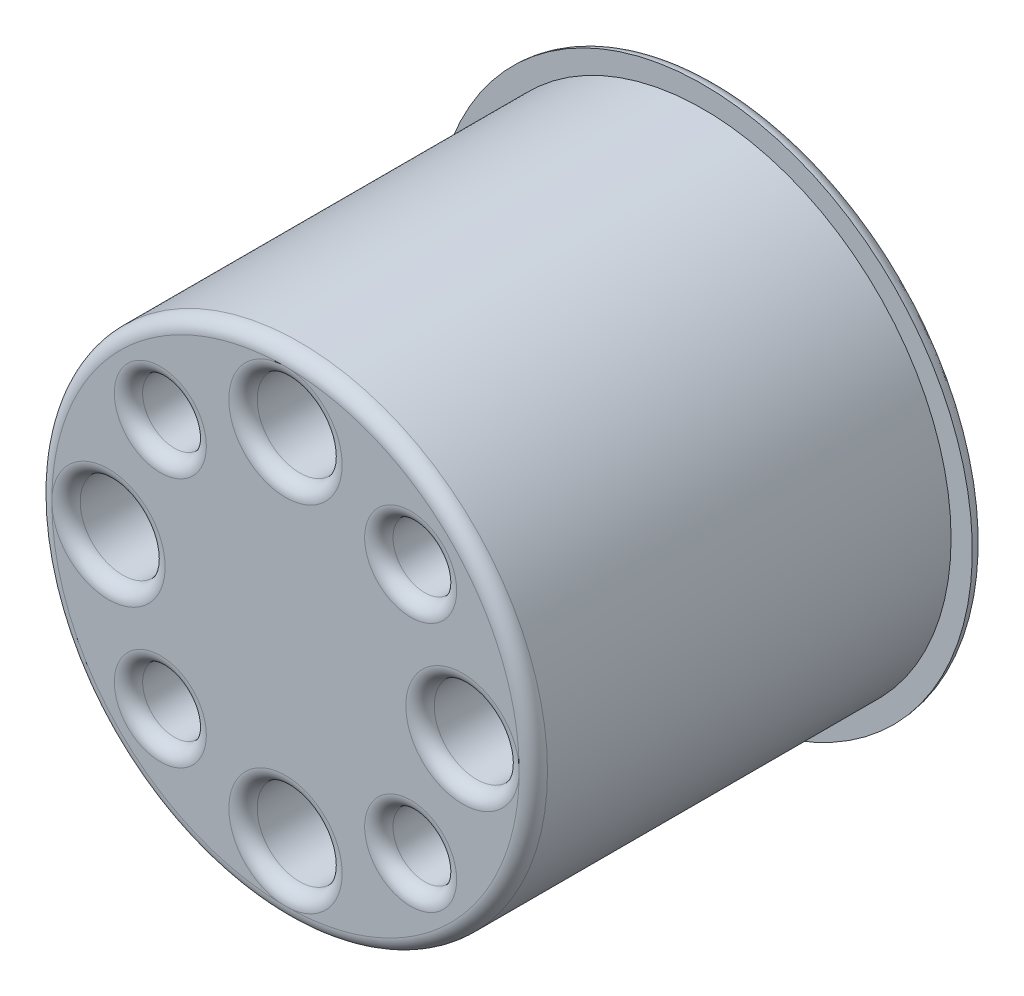
from build123d import *
from build123d.topology import SkipClean

# Parameters (mm, degrees)
SKIZZE1_R                       = 17.5
SKIZZE1_R_2                     = 1.65
AUFSATZ_LINEAR_AUSTRAGEN1_DEPTH = 29.5
AUFSATZ_LINEAR_START            = 1
SKIZZE2_R                       = 19
SKIZZE2_R_2                     = 1.65
AUFSATZ_LINEAR_AUSTRAGEN2_DEPTH = 1
SKIZZE3_R                       = 3
SCHNITT_LINEAR_AUSTRAGEN1_DEPTH = 21.5
SKIZZE4_R                       = 2.25
SCHNITT_LINEAR_AUSTRAGEN2_DEPTH = 10
VERRUNDUNG1_R                   = 1


with BuildPart() as part:
    # Skizze1 → Aufsatz-Linear austragen1 (new body)
    with BuildSketch(Plane.XY):
        Circle(SKIZZE1_R)
        with Locations((0, -12.5)):
            Circle(SKIZZE1_R_2, mode=Mode.SUBTRACT)
        with Locations((-12.5, 0)):
            Circle(SKIZZE1_R_2, mode=Mode.SUBTRACT)
        with Locations((0, 12.5)):
            Circle(SKIZZE1_R_2, mode=Mode.SUBTRACT)
        with Locations((12.5, 0)):
            Circle(SKIZZE1_R_2, mode=Mode.SUBTRACT)
    extrude(amount=AUFSATZ_LINEAR_AUSTRAGEN1_DEPTH)

    # Skizze2 → Aufsatz-Linear austragen2 (add)
    with SkipClean():  # the faces are left unmerged after this step: merging them gives an invalid solid
        with BuildSketch(Plane(origin=(0, 0, 0), x_dir=(-1, 0, 0), z_dir=(0, 0, -1)).offset(AUFSATZ_LINEAR_START)):
            Circle(SKIZZE2_R)
            with Locations((0, 12.5)):
                Circle(SKIZZE2_R_2, mode=Mode.SUBTRACT)
            with Locations((12.5, 0)):
                Circle(SKIZZE2_R_2, mode=Mode.SUBTRACT)
            with Locations((0, -12.5)):
                Circle(SKIZZE2_R_2, mode=Mode.SUBTRACT)
            with Locations((-12.5, 0)):
                Circle(SKIZZE2_R_2, mode=Mode.SUBTRACT)
        extrude(amount=-AUFSATZ_LINEAR_AUSTRAGEN2_DEPTH)

    # Skizze3 → Schnitt-Linear austragen1 (cut)
    with BuildSketch(Plane.XY.offset(29.5)):
        with Locations((0, 12.5)):
            Circle(SKIZZE3_R)
        with Locations((12.5, 0)):
            Circle(SKIZZE3_R)
        with Locations((0, -12.5)):
            Circle(SKIZZE3_R)
        with Locations((-12.5, 0)):
            Circle(SKIZZE3_R)
    extrude(amount=-SCHNITT_LINEAR_AUSTRAGEN1_DEPTH, mode=Mode.SUBTRACT)

    # Skizze4 → Schnitt-Linear austragen2 (cut)
    with BuildSketch(Plane.XY.offset(29.5)):
        with Locations((8.838834765, 8.838834765)):
            Circle(SKIZZE4_R)
        with Locations((8.838834765, -8.838834765)):
            Circle(SKIZZE4_R)
        with Locations((-8.838834765, -8.838834765)):
            Circle(SKIZZE4_R)
        with Locations((-8.838834765, 8.838834765)):
            Circle(SKIZZE4_R)
    extrude(amount=-SCHNITT_LINEAR_AUSTRAGEN2_DEPTH, mode=Mode.SUBTRACT)

    # Verrundung1
    # the kernel refuses this fillet: 1 mm, written as the material it takes off along each edge
    with BuildSketch(Plane(origin=(0, 0, -1), x_dir=(-1, 0, 0), z_dir=(0, -1, 0))) as verrundung1_piece_1:
        with BuildLine():
            CenterArc((19 - VERRUNDUNG1_R, -VERRUNDUNG1_R), VERRUNDUNG1_R, 0, 90)
            Line((19 - VERRUNDUNG1_R, 0), (19, 0))
            Line((19, 0), (19, -VERRUNDUNG1_R))
        make_face()
    revolve(axis=Axis((0, 0, -1), (0, 0, -1)), mode=Mode.SUBTRACT)
    with BuildSketch(Plane(origin=(0, 12.5, -1), x_dir=(-1, 0, 0), z_dir=(0, -1, 0))) as verrundung1_piece_2:
        with BuildLine():
            CenterArc((1.65 + VERRUNDUNG1_R, -VERRUNDUNG1_R), VERRUNDUNG1_R, 90, 90)
            Line((1.65, -VERRUNDUNG1_R), (1.65, 0))
            Line((1.65, 0), (1.65 + VERRUNDUNG1_R, 0))
        make_face()
    revolve(axis=Axis((0, 12.5, -1), (0, 0, -1)), mode=Mode.SUBTRACT)
    with BuildSketch(Plane(origin=(-12.5, 0, -1), x_dir=(-1, 0, 0), z_dir=(0, -1, 0))) as verrundung1_piece_3:
        with BuildLine():
            CenterArc((1.65 + VERRUNDUNG1_R, -VERRUNDUNG1_R), VERRUNDUNG1_R, 90, 90)
            Line((1.65, -VERRUNDUNG1_R), (1.65, 0))
            Line((1.65, 0), (1.65 + VERRUNDUNG1_R, 0))
        make_face()
    revolve(axis=Axis((-12.5, 0, -1), (0, 0, -1)), mode=Mode.SUBTRACT)
    with BuildSketch(Plane(origin=(0, -12.5, -1), x_dir=(-1, 0, 0), z_dir=(0, -1, 0))) as verrundung1_piece_4:
        with BuildLine():
            CenterArc((1.65 + VERRUNDUNG1_R, -VERRUNDUNG1_R), VERRUNDUNG1_R, 90, 90)
            Line((1.65, -VERRUNDUNG1_R), (1.65, 0))
            Line((1.65, 0), (1.65 + VERRUNDUNG1_R, 0))
        make_face()
    revolve(axis=Axis((0, -12.5, -1), (0, 0, -1)), mode=Mode.SUBTRACT)
    with BuildSketch(Plane(origin=(12.5, 0, -1), x_dir=(-1, 0, 0), z_dir=(0, -1, 0))) as verrundung1_piece_5:
        with BuildLine():
            CenterArc((1.65 + VERRUNDUNG1_R, -VERRUNDUNG1_R), VERRUNDUNG1_R, 90, 90)
            Line((1.65, -VERRUNDUNG1_R), (1.65, 0))
            Line((1.65, 0), (1.65 + VERRUNDUNG1_R, 0))
        make_face()
    revolve(axis=Axis((12.5, 0, -1), (0, 0, -1)), mode=Mode.SUBTRACT)
    with BuildSketch(Plane(origin=(0, 0, 29.5), x_dir=(1, 0, 0), z_dir=(0, -1, 0))) as verrundung1_piece_6:
        with BuildLine():
            CenterArc((17.5 - VERRUNDUNG1_R, -VERRUNDUNG1_R), VERRUNDUNG1_R, 0, 90)
            Line((17.5 - VERRUNDUNG1_R, 0), (17.5, 0))
            Line((17.5, 0), (17.5, -VERRUNDUNG1_R))
        make_face()
    revolve(axis=Axis((0, 0, 29.5), (0, 0, 1)), mode=Mode.SUBTRACT)
    with BuildSketch(Plane(origin=(0, 12.5, 29.5), x_dir=(1, 0, 0), z_dir=(0, -1, 0))) as verrundung1_piece_7:
        with BuildLine():
            CenterArc((3 + VERRUNDUNG1_R, -VERRUNDUNG1_R), VERRUNDUNG1_R, 90, 90)
            Line((3, -VERRUNDUNG1_R), (3, 0))
            Line((3, 0), (3 + VERRUNDUNG1_R, 0))
        make_face()
    revolve(axis=Axis((0, 12.5, 29.5), (0, 0, 1)), mode=Mode.SUBTRACT)
    with BuildSketch(Plane(origin=(12.5, 0, 29.5), x_dir=(1, 0, 0), z_dir=(0, -1, 0))) as verrundung1_piece_8:
        with BuildLine():
            CenterArc((3 + VERRUNDUNG1_R, -VERRUNDUNG1_R), VERRUNDUNG1_R, 90, 90)
            Line((3, -VERRUNDUNG1_R), (3, 0))
            Line((3, 0), (3 + VERRUNDUNG1_R, 0))
        make_face()
    revolve(axis=Axis((12.5, 0, 29.5), (0, 0, 1)), mode=Mode.SUBTRACT)
    with BuildSketch(Plane(origin=(0, -12.5, 29.5), x_dir=(1, 0, 0), z_dir=(0, -1, 0))) as verrundung1_piece_9:
        with BuildLine():
            CenterArc((3 + VERRUNDUNG1_R, -VERRUNDUNG1_R), VERRUNDUNG1_R, 90, 90)
            Line((3, -VERRUNDUNG1_R), (3, 0))
            Line((3, 0), (3 + VERRUNDUNG1_R, 0))
        make_face()
    revolve(axis=Axis((0, -12.5, 29.5), (0, 0, 1)), mode=Mode.SUBTRACT)
    with BuildSketch(Plane(origin=(-12.5, 0, 29.5), x_dir=(1, 0, 0), z_dir=(0, -1, 0))) as verrundung1_piece_10:
        with BuildLine():
            CenterArc((3 + VERRUNDUNG1_R, -VERRUNDUNG1_R), VERRUNDUNG1_R, 90, 90)
            Line((3, -VERRUNDUNG1_R), (3, 0))
            Line((3, 0), (3 + VERRUNDUNG1_R, 0))
        make_face()
    revolve(axis=Axis((-12.5, 0, 29.5), (0, 0, 1)), mode=Mode.SUBTRACT)
    with BuildSketch(Plane(origin=(-8.838834765, -8.838834765, 29.5), x_dir=(1, 0, 0), z_dir=(0, -1, 0))) as verrundung1_piece_11:
        with BuildLine():
            CenterArc((2.25 + VERRUNDUNG1_R, -VERRUNDUNG1_R), VERRUNDUNG1_R, 90, 90)
            Line((2.25, -VERRUNDUNG1_R), (2.25, 0))
            Line((2.25, 0), (2.25 + VERRUNDUNG1_R, 0))
        make_face()
    revolve(axis=Axis((-8.838834765, -8.838834765, 29.5), (0, 0, 1)), mode=Mode.SUBTRACT)
    with BuildSketch(Plane(origin=(8.838834765, -8.838834765, 29.5), x_dir=(1, 0, 0), z_dir=(0, -1, 0))) as verrundung1_piece_12:
        with BuildLine():
            CenterArc((2.25 + VERRUNDUNG1_R, -VERRUNDUNG1_R), VERRUNDUNG1_R, 90, 90)
            Line((2.25, -VERRUNDUNG1_R), (2.25, 0))
            Line((2.25, 0), (2.25 + VERRUNDUNG1_R, 0))
        make_face()
    revolve(axis=Axis((8.838834765, -8.838834765, 29.5), (0, 0, 1)), mode=Mode.SUBTRACT)
    with BuildSketch(Plane(origin=(8.838834765, 8.838834765, 29.5), x_dir=(1, 0, 0), z_dir=(0, -1, 0))) as verrundung1_piece_13:
        with BuildLine():
            CenterArc((2.25 + VERRUNDUNG1_R, -VERRUNDUNG1_R), VERRUNDUNG1_R, 90, 90)
            Line((2.25, -VERRUNDUNG1_R), (2.25, 0))
            Line((2.25, 0), (2.25 + VERRUNDUNG1_R, 0))
        make_face()
    revolve(axis=Axis((8.838834765, 8.838834765, 29.5), (0, 0, 1)), mode=Mode.SUBTRACT)
    with BuildSketch(Plane(origin=(-8.838834765, 8.838834765, 29.5), x_dir=(1, 0, 0), z_dir=(0, -1, 0))) as verrundung1_piece_14:
        with BuildLine():
            CenterArc((2.25 + VERRUNDUNG1_R, -VERRUNDUNG1_R), VERRUNDUNG1_R, 90, 90)
            Line((2.25, -VERRUNDUNG1_R), (2.25, 0))
            Line((2.25, 0), (2.25 + VERRUNDUNG1_R, 0))
        make_face()
    revolve(axis=Axis((-8.838834765, 8.838834765, 29.5), (0, 0, 1)), mode=Mode.SUBTRACT)


solid = part.part
